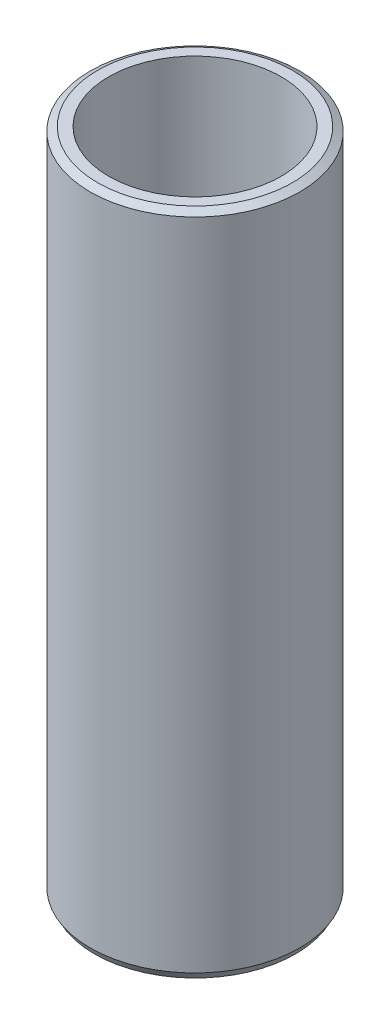
from build123d import *
from OCP.BRepFilletAPI import BRepFilletAPI_MakeChamfer

# Parameters (mm, degrees)
SKETCH1_R           = 40
BOSS_EXTRUDE1_DEPTH = 254.315129539
SKETCH2_R           = 32.929247054
CUT_EXTRUDE1_DEPTH  = 261.530583833
CHAMFER1_SIZE       = 1.635005852
CHAMFER1_SIZE2      = 2.831913206


with BuildPart() as part:
    # Sketch1 → Boss-Extrude1 (new body)
    with BuildSketch(Plane(origin=(0, 0, 0), x_dir=(1, 0, 0), z_dir=(0, 1, 0))):
        Circle(SKETCH1_R)
    extrude(amount=BOSS_EXTRUDE1_DEPTH)

    # Sketch2 → Cut-Extrude1 (cut, through all)
    with BuildSketch(Plane(origin=(0, 0, 0), x_dir=(1, 0, 0), z_dir=(0, 1, 0))):
        Circle(SKETCH2_R)
    extrude(amount=CUT_EXTRUDE1_DEPTH, mode=Mode.SUBTRACT)

    # Chamfer1: one chamfer whose edges measure the first distance from different faces: ONE call of the kernel's chamfer builder (chamfer() names one face for all edges)
    chamfer1_edges_1 = [part.edges().sort_by_distance(p)[0] for p in [
        (-40, 254.315129539, 0),
    ]]
    chamfer1_side_1 = [part.faces().sort_by_distance(p)[0] for p in [
        (-40, 127.157564769, 0),
    ]]
    chamfer1_edges_2 = [part.edges().sort_by_distance(p)[0] for p in [
        (-40, 0, 0),
    ]]
    chamfer1_side_2 = [part.faces().sort_by_distance(p)[0] for p in [
        (-38.86862915, 0, 0),
    ]]
    chamfer1 = BRepFilletAPI_MakeChamfer(part.part.solid().wrapped)
    for e in chamfer1_edges_1:
        chamfer1.Add(CHAMFER1_SIZE, CHAMFER1_SIZE2, e.wrapped, chamfer1_side_1[0].wrapped)  # the first distance lies on this face
    for e in chamfer1_edges_2:
        chamfer1.Add(CHAMFER1_SIZE, CHAMFER1_SIZE2, e.wrapped, chamfer1_side_2[0].wrapped)  # the first distance lies on this face
    add(Compound.cast(chamfer1.Shape()), mode=Mode.REPLACE)


solid = part.part
